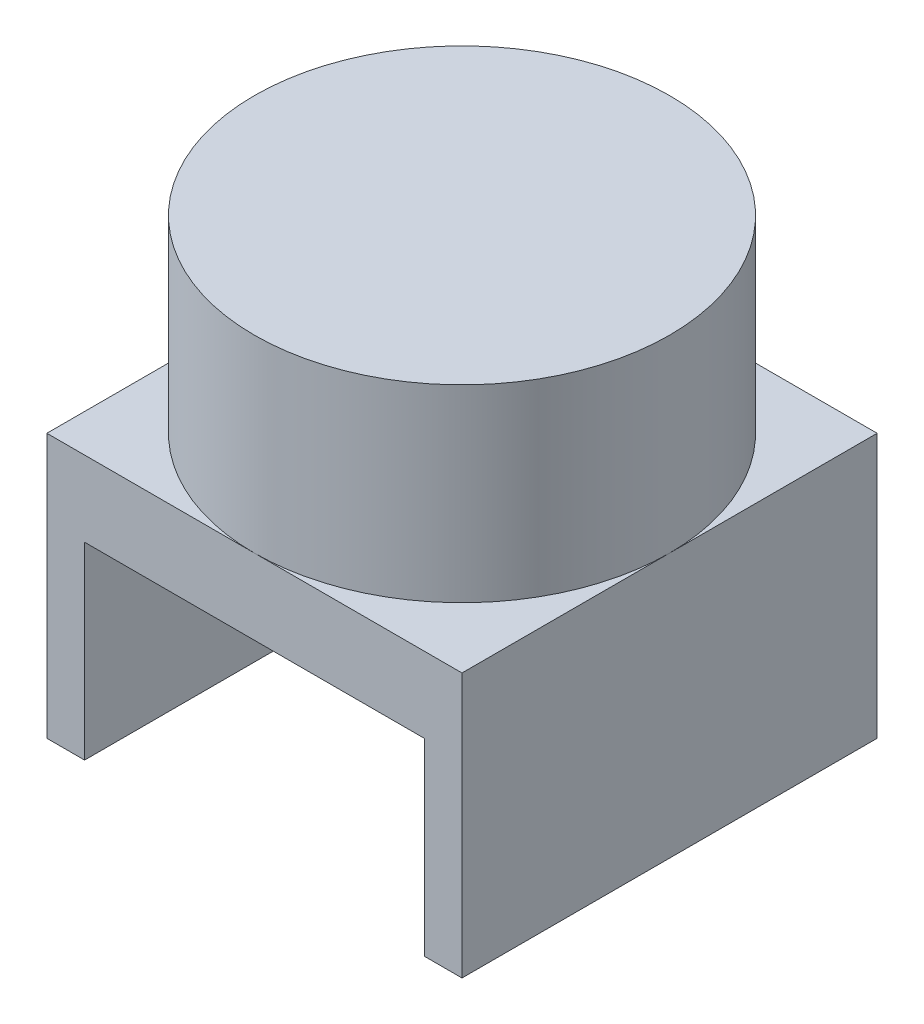
from build123d import *

# Parameters (mm, degrees)
SKETCH1_R           = 55
BOSS_EXTRUDE1_DEPTH = 50
SKETCH2_W           = 110
SKETCH2_H           = 110
BOSS_EXTRUDE2_DEPTH = 20
SKETCH3_W           = 10
SKETCH3_H           = 110
BOSS_EXTRUDE3_DEPTH = 50


with BuildPart() as part:
    # Sketch1 → Boss-Extrude1 (new body)
    with BuildSketch(Plane(origin=(0, 0, 0), x_dir=(1, 0, 0), z_dir=(0, 1, 0))):
        Circle(SKETCH1_R)
    extrude(amount=BOSS_EXTRUDE1_DEPTH)

    # Sketch2 → Boss-Extrude2 (add)
    with BuildSketch(Plane(origin=(0, 0, 0), x_dir=(-1, 0, 0), z_dir=(0, -1, 0))):
        Rectangle(SKETCH2_W, SKETCH2_H)
    extrude(amount=BOSS_EXTRUDE2_DEPTH)

    # Sketch3 → Boss-Extrude3 (add)
    with BuildSketch(Plane(origin=(0, -20, 0), x_dir=(-1, 0, 0), z_dir=(0, -1, 0))):
        with Locations((50, 0)):
            Rectangle(SKETCH3_W, SKETCH3_H)
        with Locations((-50, 0)):
            Rectangle(SKETCH3_W, SKETCH3_H)
    extrude(amount=BOSS_EXTRUDE3_DEPTH)


solid = part.part
